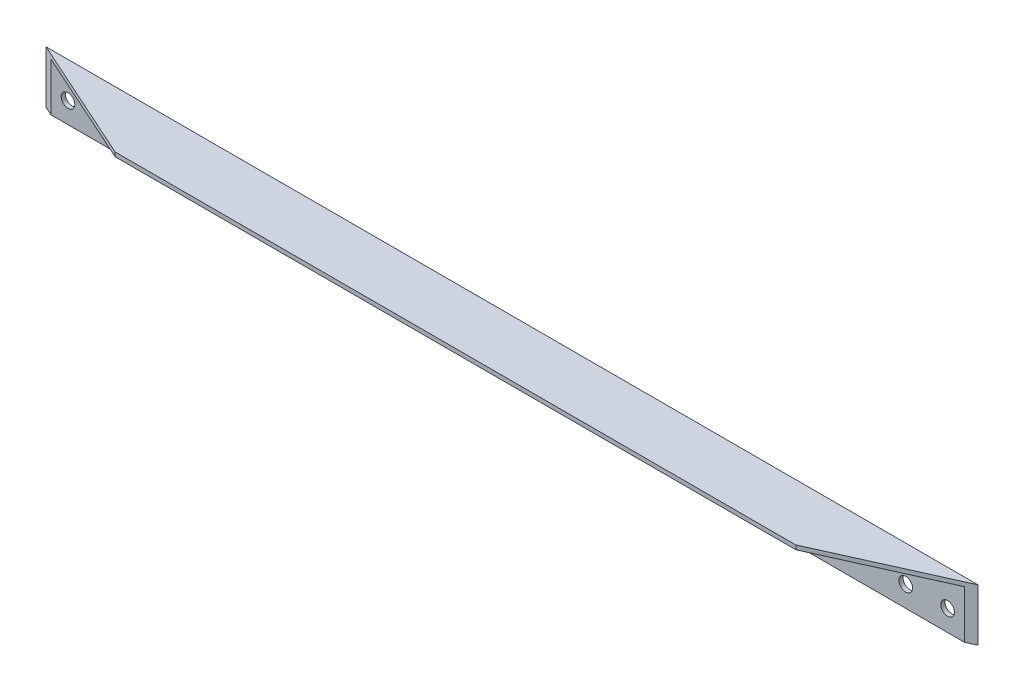
from build123d import *

# Parameters (mm, degrees)
SKETCH_1_W          = 1780
SKETCH_1_H          = 100
SKETCH_1_R          = 13
EXTRUDE_499_DEPTH   = 8
SKETCH_2_W          = 1780
SKETCH_2_H          = 8
EXTRUDE_1_DEPTH     = 100
CUT_EXTRUDE_1_DEPTH = 903.088687436


with BuildPart() as part:
    # 草图1 → Extrude 499 (new body)
    with BuildSketch(Plane.XY):
        with Locations((0, 50)):
            Rectangle(SKETCH_1_W, SKETCH_1_H)
        with Locations((840, 40)):
            Circle(SKETCH_1_R, mode=Mode.SUBTRACT)
        with Locations((760, 40)):
            Circle(SKETCH_1_R, mode=Mode.SUBTRACT)
        with Locations((-840, 40)):
            Circle(SKETCH_1_R, mode=Mode.SUBTRACT)
        with Locations((-760, 40)):
            Circle(SKETCH_1_R, mode=Mode.SUBTRACT)
    extrude(amount=EXTRUDE_499_DEPTH)

    # 草图2 → 凸台-拉伸1 (add)
    with BuildSketch(Plane.XY.offset(8)):
        with Locations((0, 96)):
            Rectangle(SKETCH_2_W, SKETCH_2_H)
    extrude(amount=EXTRUDE_1_DEPTH)

    # 草图3 → 切除-拉伸1 (cut, through all)
    with BuildSketch(Plane(origin=(0, 100, 0), x_dir=(-1, 0, 0), z_dir=(0, 1, 0))):
        Polygon((-650, 108), (-890, 0), (-890, 108), align=None)
        Polygon((890, 108), (650, 108), (890, 0), align=None)
    extrude(amount=-CUT_EXTRUDE_1_DEPTH, mode=Mode.SUBTRACT)


solid = part.part
